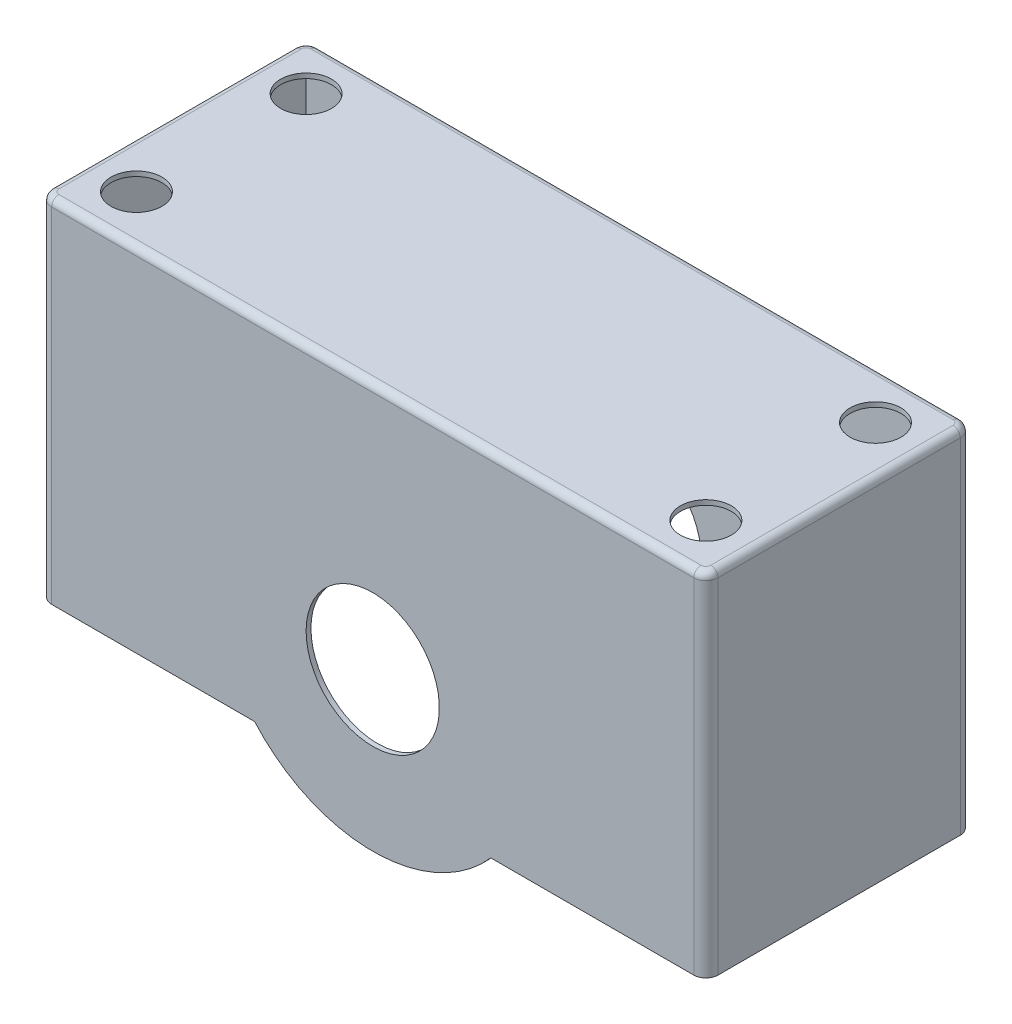
from build123d import *

# Parameters (mm, degrees)
BOSS_EXTRU_1_DEPTH      = 55
COQUE1_T                = -2
ESQUISSE2_R             = 27.5
ENL_V_MAT_EXTRU_1_DEPTH = 200.841186946
ESQUISSE3_R             = 10.5
ENL_V_MAT_EXTRU_2_DEPTH = 224.204502643
CONG_2_R                = 3
CONG_3_R                = 5


with BuildPart() as part:
    # Esquisse1 → Boss.-Extru.1 (new, symmetric)
    with BuildSketch(Plane.XY):
        with BuildLine():
            Line((-137.5, 72.5), (137.5, 72.5))
            Line((137.5, 72.5), (137.5, -72.5))
            Line((137.5, -72.5), (48.744230428, -72.5))
            ThreePointArc((48.744230428, -72.5), (0, -94.5), (-48.744230428, -72.5))
            Line((-48.744230428, -72.5), (-137.5, -72.5))
            Line((-137.5, -72.5), (-137.5, 72.5))
        make_face()
    extrude(amount=BOSS_EXTRU_1_DEPTH, both=True)

    # Coque1
    coque1_openings = [part.faces().sort_by_distance(p)[0] for p in [
        (93.122115214, -72.5, 0),
        (0, -94.5, 0),
        (-93.122115214, -72.5, 0),
    ]]
    offset(amount=COQUE1_T, openings=coque1_openings, kind=Kind.INTERSECTION)

    # Esquisse2 → Enlèv. mat.-Extru.1 (cut, through all)
    with BuildSketch(Plane(origin=(0, 0, -55), x_dir=(-1, 0, 0), z_dir=(0, 0, -1))):
        with Locations((0, -29.5)):
            Circle(ESQUISSE2_R)
    extrude(amount=-ENL_V_MAT_EXTRU_1_DEPTH, mode=Mode.SUBTRACT)

    # Esquisse3 → Enlèv. mat.-Extru.2 (cut, through all)
    with BuildSketch(Plane(origin=(0, 72.5, 0), x_dir=(1, 0, 0), z_dir=(0, 1, 0))):
        with Locations(Location((-117.5, 35, 0), (0, 0, 270))):
            Circle(ESQUISSE3_R)
        with Locations(Location((-117.5, -35, 0), (0, 0, 270))):
            Circle(ESQUISSE3_R)
        with Locations(Location((117.5, 35, 0), (0, 0, 90))):
            Circle(ESQUISSE3_R)
        with Locations(Location((117.5, -35, 0), (0, 0, 90))):
            Circle(ESQUISSE3_R)
    extrude(amount=-ENL_V_MAT_EXTRU_2_DEPTH, mode=Mode.SUBTRACT)

    # Congé2
    cong_2_edges = [part.edges().sort_by_distance(p)[0] for p in [
        (-137.5, 72.5, 0),
        (137.5, 72.5, 0),
        (0, 72.5, 55),
        (0, 72.5, -55),
    ]]
    fillet(cong_2_edges, radius=CONG_2_R)

    # Congé3
    # the kernel refuses this fillet: 5 mm, written as the material it takes off along each edge
    with BuildSketch(Plane(origin=(-132.5, 72.5, 50), x_dir=(-1, 0, 0), z_dir=(0, 0, -1))) as cong_3_piece_1:
        with BuildLine():
            CenterArc((2, -3), 3, 0, 90)
            Line((5, -3), (5, 0))
            Line((5, 0), (2, 0))
        make_face()
    revolve(axis=Axis((-132.5, 72.5, 50), (0, 1, 0)), revolution_arc=90, mode=Mode.SUBTRACT)
    with BuildSketch(Plane(origin=(-132.5, 72.5, -50), x_dir=(0, 0, -1), z_dir=(1, 0, 0))) as cong_3_piece_2:
        with BuildLine():
            CenterArc((2, -3), 3, 0, 90)
            Line((5, -3), (5, 0))
            Line((5, 0), (2, 0))
        make_face()
    revolve(axis=Axis((-132.5, 72.5, -50), (0, 1, 0)), revolution_arc=90, mode=Mode.SUBTRACT)
    with BuildSketch(Plane(origin=(132.5, 72.5, 50), x_dir=(0, 0, 1), z_dir=(-1, 0, 0))) as cong_3_piece_3:
        with BuildLine():
            CenterArc((2, -3), 3, 0, 90)
            Line((5, -3), (5, 0))
            Line((5, 0), (2, 0))
        make_face()
    revolve(axis=Axis((132.5, 72.5, 50), (0, 1, 0)), revolution_arc=90, mode=Mode.SUBTRACT)
    with BuildSketch(Plane(origin=(132.5, 72.5, -50), x_dir=(1, 0, 0), z_dir=(0, 0, 1))) as cong_3_piece_4:
        with BuildLine():
            CenterArc((2, -3), 3, 0, 90)
            Line((5, -3), (5, 0))
            Line((5, 0), (2, 0))
        make_face()
    revolve(axis=Axis((132.5, 72.5, -50), (0, 1, 0)), revolution_arc=90, mode=Mode.SUBTRACT)
    with BuildSketch(Plane(origin=(137.5, 72.5, 55), x_dir=(-1, 0, 0), z_dir=(0, -1, 0)), Plane(origin=(137.5, 72.5, -55), x_dir=(0, 0, 1), z_dir=(0, -1, 0)), Plane(origin=(-137.5, -85, -55), x_dir=(0, 0, 1), z_dir=(0, 1, 0)), Plane(origin=(-137.5, -85, 55), x_dir=(1, 0, 0), z_dir=(0, 1, 0))) as cong_3_piece_5:
        with BuildLine():
            CenterArc((CONG_3_R, CONG_3_R), CONG_3_R, 180, 90)
            Line((0, CONG_3_R), (0, 0))
            Line((0, 0), (CONG_3_R, 0))
        make_face()
    extrude(amount=157.5, mode=Mode.SUBTRACT)


solid = part.part
